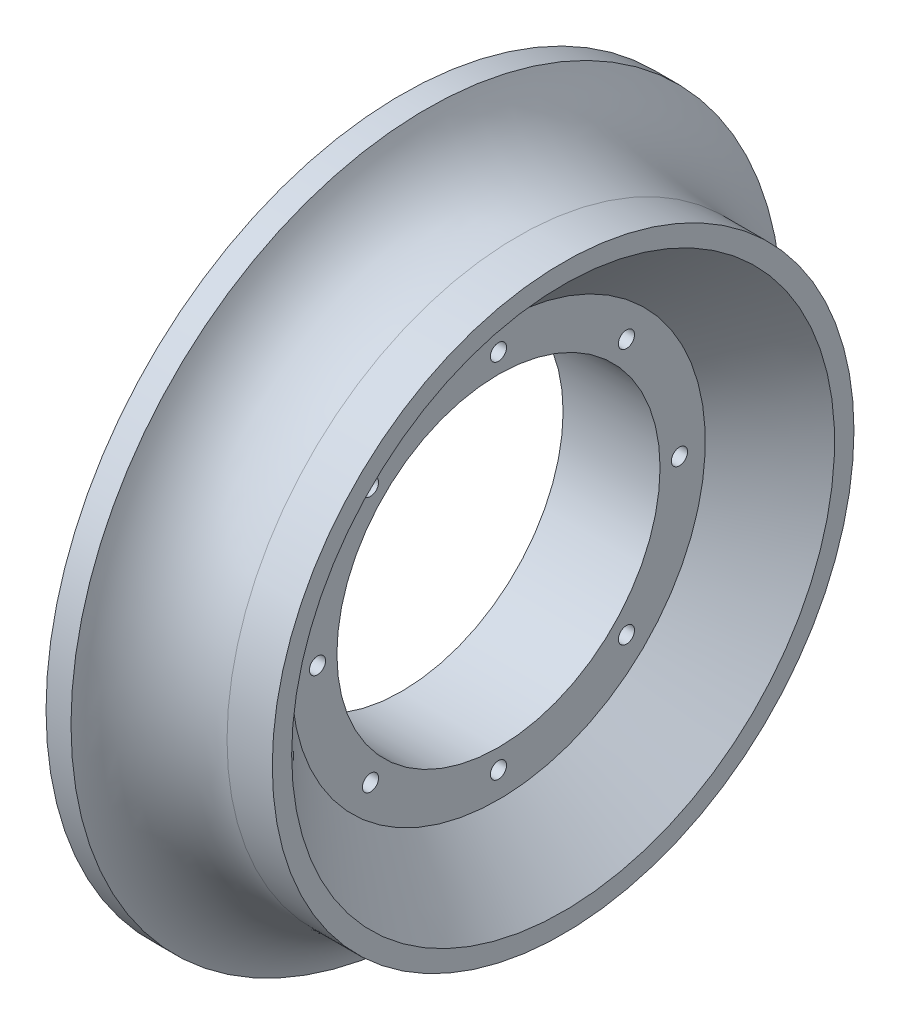
from build123d import *

# Parameters (mm, degrees)
SZKIC2_R                   = 2.5
WYTNIJ_WYCI_GNI_CIE1_DEPTH = 164.401346356


with BuildPart() as part:
    # Szkic1 → Obrót1 (revolve)
    with BuildSketch(Plane.XY):
        with BuildLine():
            Line((49.999999909, 90), (49.999999909, 84))
            Line((49.999999909, 84), (29.999999909, 64))
            Line((29.999999909, 64), (29.999999909, 50))
            Line((29.999999909, 50), (0, 50))
            Line((0, 50), (0, 110))
            Line((0, 110), (7.71572874, 110))
            ThreePointArc((7.71572874, 110), (18.679491911, 95.505102572), (35.999999987, 90))
            Line((35.999999987, 90), (49.999999909, 90))
        make_face()
    revolve(axis=Axis((0, 0, 0), (1, 0, 0)))

    # Szkic2 → Wytnij-wyciągnięcie1 (cut, through all)
    with BuildSketch(Plane.ZY):
        with Locations((0, 56)):
            Circle(SZKIC2_R)
        with Locations((39.597979746, 39.597979746)):
            Circle(SZKIC2_R)
        with Locations((56, 0)):
            Circle(SZKIC2_R)
        with Locations((39.597979746, -39.597979746)):
            Circle(SZKIC2_R)
        with Locations((0, -56)):
            Circle(SZKIC2_R)
        with Locations((-39.597979746, -39.597979746)):
            Circle(SZKIC2_R)
        with Locations((-56, 0)):
            Circle(SZKIC2_R)
        with Locations((-39.597979746, 39.597979746)):
            Circle(SZKIC2_R)
    extrude(amount=-WYTNIJ_WYCI_GNI_CIE1_DEPTH, mode=Mode.SUBTRACT)


solid = part.part
